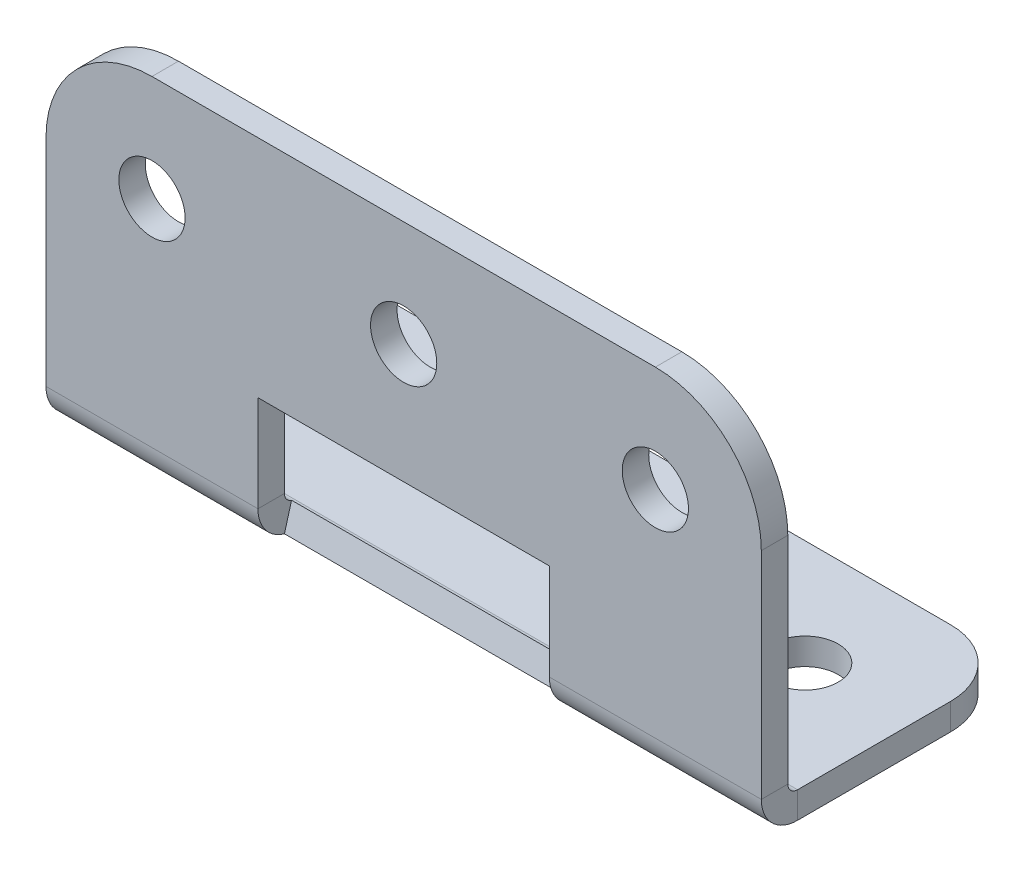
from build123d import *

# Parameters (mm, degrees)
SKETCH1_R                    = 2.5
BASE_FLANGE1_DEPTH           = 2
EDGE_FLANGE1_STRIP_W         = 9.4732
EDGE_FLANGE1_STRIP_H         = 2
EDGE_FLANGE1_STRIP_CUT_DEPTH = 54
EDGE_FLANGE1_DEPTH           = 54
CUT_EXTRUDE1_START           = 16
CUT_EXTRUDE1_DEPTH           = 22
SKETCH10_R                   = 2.5
CUT_EXTRUDE2_DEPTH           = 10
SKETCH11_W                   = 22
SKETCH11_H                   = 17
SKETCH11_R                   = 2.5
BOSS_EXTRUDE1_DEPTH          = 2


# Read off the part's stored shape, not the designer's step: Cut-Extrude1
# Sheet-metal steps are written as plain solids
with BuildPart() as part:
    # Sketch1 → Base-Flange1 (new body)
    with BuildSketch(Plane(origin=(0, 0, 0), x_dir=(1, 0, 0), z_dir=(0, 1, 0))):
        with BuildLine():
            Line((0, 0), (54, 0))
            Line((54, 0), (54, 12.3))
            ThreePointArc((54, 12.3), (52.535533906, 15.835533906), (49, 17.3))
            Line((49, 17.3), (5, 17.3))
            ThreePointArc((5, 17.3), (1.464466094, 15.835533906), (0, 12.3))
            Line((0, 12.3), (0, 0))
        make_face()
        with Locations(Location((8, 9.3, 0), (0, 0, 270))):
            Circle(SKETCH1_R, mode=Mode.SUBTRACT)
        with Locations(Location((46, 9.3, 0), (0, 0, 90))):
            Circle(SKETCH1_R, mode=Mode.SUBTRACT)
    extrude(amount=-BASE_FLANGE1_DEPTH)

    # Edge-Flange1 strip (across the edge) → Edge-Flange1 strip cut (cut)
    with BuildSketch(Plane(origin=(0, 0, 0), x_dir=(0, 0, -1), z_dir=(1, 0, 0))):
        with Locations((-4, -1)):
            Rectangle(EDGE_FLANGE1_STRIP_W, EDGE_FLANGE1_STRIP_H)
    extrude(amount=EDGE_FLANGE1_STRIP_CUT_DEPTH, mode=Mode.SUBTRACT)

    # Edge-Flange1 section (across the edge) → Edge-Flange1 (add)
    with BuildSketch(Plane(origin=(0, 0, 0), x_dir=(0, 0, -1), z_dir=(1, 0, 0))):
        with BuildLine():
            Line((-2, 0.7366), (-2, 25))
            Line((-2, 25), (0, 25))
            Line((0, 25), (0, 0.7366))
            ThreePointArc((0, 0.7366), (0.215745145, 0.215745145), (0.7366, 0))
            Line((0.7366, 0), (0.7366, -2))
            ThreePointArc((0.7366, -2), (-1.198468417, -1.198468417), (-2, 0.7366))
        make_face()
    extrude(amount=EDGE_FLANGE1_DEPTH)

    # Cut-Extrude1 outline → Cut-Extrude1 (cut)
    with BuildSketch(Plane.YZ.offset(CUT_EXTRUDE1_START)):
        with BuildLine():
            Line((-1.899002398, 0), (0.027185133, -0.538332237))
            ThreePointArc((0.027185133, -0.538332237), (0.291327316, -0.149819123), (0.7366, 0))
            Line((0.7366, 0), (25, 0))
            Line((25, 0), (25, 2))
            Line((25, 2), (0.7366, 2))
            ThreePointArc((0.7366, 2), (-0.917667209, 1.443395312), (-1.899002398, 0))
        make_face()
    extrude(amount=CUT_EXTRUDE1_DEPTH, mode=Mode.SUBTRACT)

    # Sketch10 → Cut-Extrude2 (cut)
    with BuildSketch(Plane.XY.offset(2)):
        with BuildLine():
            ThreePointArc((46, 25), (51.656854249, 22.656854249), (54, 17))
            Line((54, 17), (54, 25))
            Line((54, 25), (46, 25))
        make_face()
        with Locations((46, 17)):
            Circle(SKETCH10_R)
        with Locations((8, 17)):
            Circle(SKETCH10_R)
        with BuildLine():
            ThreePointArc((0, 17), (2.343145728, 22.656854227), (7.999999938, 25))
            Line((7.999999938, 25), (0, 25))
            Line((0, 25), (0, 17))
        make_face()
    extrude(amount=-CUT_EXTRUDE2_DEPTH, mode=Mode.SUBTRACT)

    # Sketch11 → Boss-Extrude1 (add)
    with BuildSketch(Plane.XY.offset(2)):
        with Locations((27, 16.5)):
            Rectangle(SKETCH11_W, SKETCH11_H)
        with Locations((27, 17)):
            Circle(SKETCH11_R, mode=Mode.SUBTRACT)
    extrude(amount=-BOSS_EXTRUDE1_DEPTH)


solid = part.part
